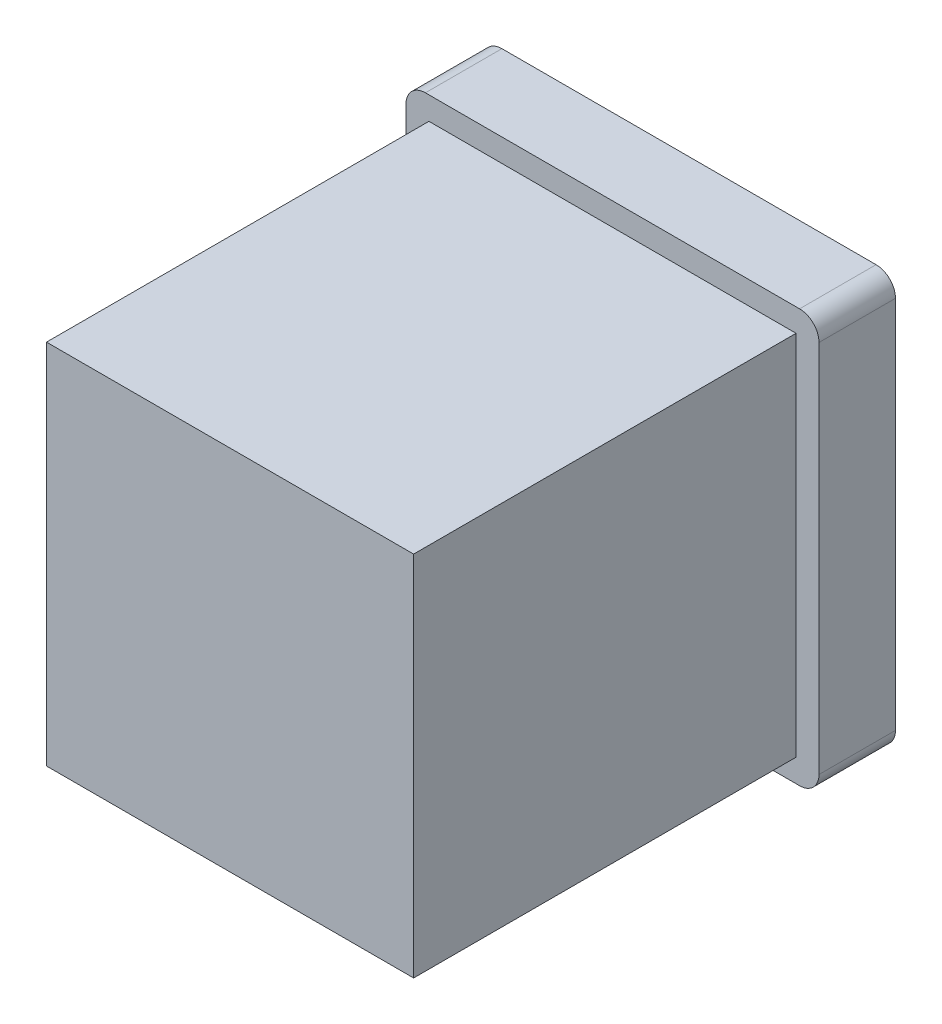
from build123d import *

# Parameters (mm, degrees)
SKETCH1_W           = 27
SKETCH1_H           = 27
BOSS_EXTRUDE1_DEPTH = 5
SKETCH2_W           = 24
SKETCH2_H           = 24
BOSS_EXTRUDE2_DEPTH = 25
FILLET1_R           = 1.27
SKETCH3_W           = 2.54
SKETCH3_H           = 7.62
CUT_EXTRUDE1_DEPTH  = 2.54


with BuildPart() as part:
    # Sketch1 → Boss-Extrude1 (new body)
    with BuildSketch(Plane.XY):
        with Locations((13.5, 13.5)):
            Rectangle(SKETCH1_W, SKETCH1_H)
    extrude(amount=BOSS_EXTRUDE1_DEPTH)

    # Sketch2 → Boss-Extrude2 (add)
    with BuildSketch(Plane.XY.offset(5)):
        with Locations((13.5, 13.5)):
            Rectangle(SKETCH2_W, SKETCH2_H)
    extrude(amount=BOSS_EXTRUDE2_DEPTH)

    # Fillet1
    fillet1_edges = [part.edges().sort_by_distance(p)[0] for p in [
        (0, 0, 2.5),
        (27, 0, 2.5),
        (0, 27, 2.5),
        (27, 27, 2.5),
    ]]
    fillet(fillet1_edges, radius=FILLET1_R)

    # Sketch3 → Cut-Extrude1 (cut)
    with BuildSketch(Plane(origin=(0, 0, 0), x_dir=(-1, 0, 0), z_dir=(0, 0, -1))):
        with Locations((-19.38, 19.38)):
            Rectangle(SKETCH3_W, SKETCH3_H)
        with Locations((-7.62, 19.38)):
            Rectangle(SKETCH3_W, SKETCH3_H)
        with BuildLine():
            Line((-16.164953657, 5.08), (-16.164953657, 8.636))
            ThreePointArc((-16.164953657, 8.636), (-13.624953657, 10.494493494), (-11.084953657, 8.636))
            Line((-11.084953657, 8.636), (-11.084953657, 5.08))
            Line((-11.084953657, 5.08), (-16.164953657, 5.08))
        make_face()
    extrude(amount=-CUT_EXTRUDE1_DEPTH, mode=Mode.SUBTRACT)


solid = part.part
